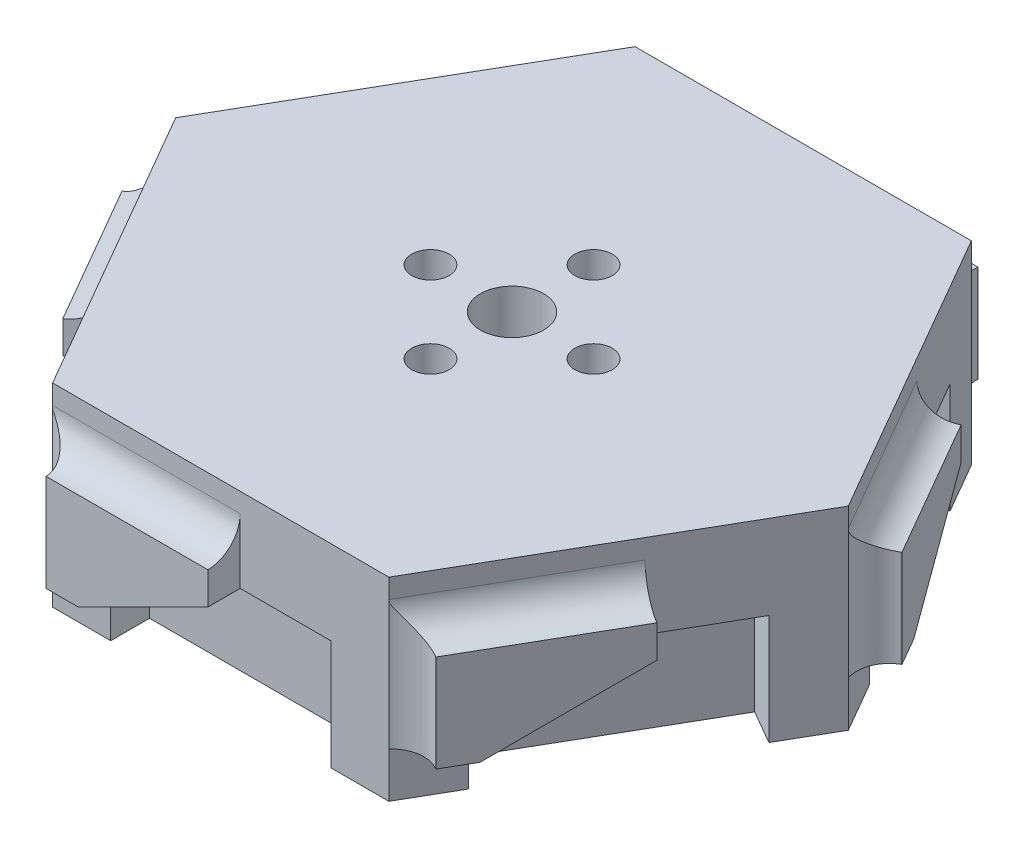
from build123d import *

# Parameters (mm, degrees)
BOSS_EXTRUDE1_DEPTH = 19.05
SKETCH2_W           = 10.795
SKETCH2_H           = 10.795
CUT_EXTRUDE1_DEPTH  = 3.81
BOSS_EXTRUDE2_DEPTH = 3.175
CIRPATTERN1_COUNT   = 6
SKETCH6_R           = 3.1
SKETCH6_R_2         = 1.83388
CUT_EXTRUDE3_DEPTH  = 51.595706367
FILLET1_R           = 3.175


with BuildPart() as part:
    # Sketch1 → Boss-Extrude1 (new body)
    with BuildSketch(Plane(origin=(0, 0, 0), x_dir=(1, 0, 0), z_dir=(0, 1, 0))):
        Polygon((16.497783942, 28.575), (-16.497783942, 28.575), (-32.995567884, 0), (-16.497783942, -28.575), (16.497783942, -28.575), (32.995567884, 0), align=None)
    extrude(amount=BOSS_EXTRUDE1_DEPTH)

    # Sketch2 → Cut-Extrude1 (cut)
    with BuildSketch(Plane(origin=(24.746675913, 0, 14.2875), x_dir=(0.4999999999999996, 0, -0.8660254037844389), z_dir=(0.8660254037844388, 0, 0.49999999999999956))):
        with Locations((-5.3975, 5.3975)):
            Rectangle(SKETCH2_W, SKETCH2_H)
        with Locations((5.3975, 5.3975)):
            Rectangle(SKETCH2_W, SKETCH2_H)
    cut_extrude1 = extrude(amount=-CUT_EXTRUDE1_DEPTH, mode=Mode.SUBTRACT)

    # Sketch3 → Boss-Extrude2 (add)
    with BuildSketch(Plane(origin=(24.746675913, 0, 14.2875), x_dir=(0.4999999999999996, 0, -0.8660254037844389), z_dir=(0.8660254037844388, 0, 0.49999999999999956))):
        Polygon((-13.97, 13.97), (-13.97, 4.445), (-10.795, 4.445), (1.905, 10.795), (1.905, 13.97), align=None)
    boss_extrude2 = extrude(amount=BOSS_EXTRUDE2_DEPTH)

    # CirPattern1: Cut-Extrude1, Boss-Extrude2 ×6 about axis
    cirpattern1_axis = Axis((0, 0, 0), (0, 1, 0))
    add([cut_extrude1.rotate(cirpattern1_axis, i * 360 / CIRPATTERN1_COUNT) for i in range(1, CIRPATTERN1_COUNT)], mode=Mode.SUBTRACT)
    add([boss_extrude2.rotate(cirpattern1_axis, i * 360 / CIRPATTERN1_COUNT) for i in range(1, CIRPATTERN1_COUNT)])

    # Sketch6 → Cut-Extrude3 (cut, through all)
    with BuildSketch(Plane(origin=(0, 19.05, 0), x_dir=(1, 0, 0), z_dir=(0, 1, 0))):
        with Locations(Location((0, 0, 0), (0, 0, 270))):
            Circle(SKETCH6_R)
        with Locations(Location((0, 8, 0), (0, 0, 270))):
            Circle(SKETCH6_R_2)
        with Locations(Location((8, 0, 0), (0, 0, 270))):
            Circle(SKETCH6_R_2)
        with Locations(Location((0, -8, 0), (0, 0, 270))):
            Circle(SKETCH6_R_2)
        with Locations(Location((-8, 0, 0), (0, 0, 270))):
            Circle(SKETCH6_R_2)
    extrude(amount=-CUT_EXTRUDE3_DEPTH, mode=Mode.SUBTRACT)

    # Fillet1
    # the kernel refuses this fillet: 3.175 mm, written as the material it adds along each edge
    with BuildSketch(Plane(origin=(-13.97, 13.97, 28.575), x_dir=(-1.0, -6.713789629229293e-15, 2.071656471641608e-12), z_dir=(0, -1, 0)), Plane(origin=(-31.731675913, 13.97, 2.189125109), x_dir=(-0.5000000000017967, -6.713789629229294e-15, -0.8660254037834013), z_dir=(0, -1, 0)), Plane(origin=(-17.761675913, 13.97, -26.385874891), x_dir=(0.4999999999982169, -6.713789629229294e-15, -0.866025403785468), z_dir=(0, -1, 0)), Plane(origin=(13.97, 13.97, -28.575), x_dir=(1.0, -6.713789629229294e-15, -2.032303431474765e-12), z_dir=(0, -1, 0)), Plane(origin=(31.731675913, 13.97, -2.189125109), x_dir=(0.5000000000017165, -6.7137896292292946e-15, 0.8660254037834476), z_dir=(0, -1, 0)), Plane(origin=(17.761675913, 13.97, 26.385874891), x_dir=(-0.49999999999821076, -6.713789629229294e-15, 0.8660254037854717), z_dir=(0, -1, 0))) as fillet1_piece_1:
        with BuildLine():
            CenterArc((3.175, -3.108333376), FILLET1_R, 101.762045639, 78.237954362)
            Line((0, -3.108333376), (-0.0635, -3.108333376))
            Line((-0.0635, -3.108333376), (-0.0635, 0))
            Line((-0.0635, 0), (0, 0.0635))
            ThreePointArc((0, 0.0635), (1.263891971, 0.0635), (2.514839621, 0.062166668))
            Line((2.514839621, 0.062166668), (2.527783942, 0))
        make_face()
    extrude(amount=9.525)
    with BuildSketch(Plane(origin=(1.905, 13.97, 28.575), x_dir=(0, 1, 0), z_dir=(-1, 0, 0)), Plane(origin=(-23.794175913, 13.97, 15.937278394), x_dir=(0, 1, 0), z_dir=(-0.5, 0, -0.8660254037844387)), Plane(origin=(-25.699175913, 13.97, -12.637721606), x_dir=(0, 1, 0), z_dir=(0.4999999999999997, 0, -0.8660254037844388)), Plane(origin=(-1.905, 13.97, -28.575), x_dir=(0, 1, 0), z_dir=(1, 0, 0)), Plane(origin=(23.794175913, 13.97, -15.937278394), x_dir=(0, 1, 0), z_dir=(0.5000000000000003, 0, 0.8660254037844386)), Plane(origin=(25.699175913, 13.97, 12.637721606), x_dir=(0, 1, 0), z_dir=(-0.4999999999999996, 0, 0.8660254037844389))) as fillet1_piece_2:
        with BuildLine():
            CenterArc((FILLET1_R, -FILLET1_R), FILLET1_R, 90, 90)
            Line((0, -FILLET1_R), (-FILLET1_R * 0.02, -FILLET1_R))
            Line((-FILLET1_R * 0.02, -FILLET1_R), (-FILLET1_R * 0.02, FILLET1_R * 0.02))
            Line((-FILLET1_R * 0.02, FILLET1_R * 0.02), (FILLET1_R, FILLET1_R * 0.02))
            Line((FILLET1_R, FILLET1_R * 0.02), (FILLET1_R, 0))
        make_face()
    extrude(amount=15.875)
    with BuildSketch(Plane(origin=(-13.97, 21.740833439, 28.575), x_dir=(-1.0, -6.713789629229294e-15, 2.08290019740361e-12), z_dir=(0, -1, 0))) as fillet1_piece_3a_section:
        with BuildLine():
            CenterArc((3.175, -3.108333376), FILLET1_R, 101.762045639, 78.237954362)
            Line((0, -3.108333376), (-0.0635, -3.108333376))
            Line((-0.0635, -3.108333376), (-0.0635, 0))
            Line((-0.0635, 0), (0, 0.0635))
            ThreePointArc((0, 0.0635), (1.263891971, 0.0635), (2.514839621, 0.062166668))
            Line((2.514839621, 0.062166668), (2.527783942, 0))
        make_face()
    fillet1_piece_3a = extrude(amount=17.295833439, mode=Mode.PRIVATE)
    fillet1_piece_3a = split(fillet1_piece_3a, bisect_by=Plane(origin=(-14.601274605, 19.05, 29.300800837), z_dir=(0, -1, 0)), keep=Keep.TOP, mode=Mode.PRIVATE)
    fillet1_piece_3a = split(fillet1_piece_3a, bisect_by=Plane(origin=(-14.601274605, 13.97, 29.300800837), z_dir=(0, 1, 0)), keep=Keep.TOP, mode=Mode.PRIVATE)
    with BuildSketch(Plane(origin=(1.905, 13.97, 28.575), x_dir=(0, 1, 0), z_dir=(-1, 0, 0))) as fillet1_piece_3b_section:
        with BuildLine():
            CenterArc((FILLET1_R, -FILLET1_R), FILLET1_R, 90, 90)
            Line((0, -FILLET1_R), (-FILLET1_R * 0.02, -FILLET1_R))
            Line((-FILLET1_R * 0.02, -FILLET1_R), (-FILLET1_R * 0.02, FILLET1_R * 0.02))
            Line((-FILLET1_R * 0.02, FILLET1_R * 0.02), (FILLET1_R, FILLET1_R * 0.02))
            Line((FILLET1_R, FILLET1_R * 0.02), (FILLET1_R, 0))
        make_face()
    fillet1_piece_3b = extrude(amount=23.8125, mode=Mode.PRIVATE)
    fillet1_piece_3b = split(fillet1_piece_3b, bisect_by=Plane(origin=(-15.883361885, 14.764439111, 29.63921022), z_dir=(0.8660254037844387, 0, -0.5000000000000003)), keep=Keep.TOP, mode=Mode.PRIVATE)
    fillet1_piece_3b = split(fillet1_piece_3b, bisect_by=Plane(origin=(-13.97, 14.764439111, 29.165775935), z_dir=(-1, 0, 0)), keep=Keep.TOP, mode=Mode.PRIVATE)
    fillet1_piece_3 = fillet1_piece_3a & fillet1_piece_3b
    add(fillet1_piece_3)
    with BuildSketch(Plane(origin=(-31.731675913, 21.740833439, 2.189125109), x_dir=(-0.5000000000018066, -6.7137896292292946e-15, -0.8660254037833955), z_dir=(0, -1, 0))) as fillet1_piece_4a_section:
        with BuildLine():
            CenterArc((3.175, -3.108333376), FILLET1_R, 101.762045639, 78.237954362)
            Line((0, -3.108333376), (-0.0635, -3.108333376))
            Line((-0.0635, -3.108333376), (-0.0635, 0))
            Line((-0.0635, 0), (0, 0.0635))
            ThreePointArc((0, 0.0635), (1.263891971, 0.0635), (2.514839621, 0.062166668))
            Line((2.514839621, 0.062166668), (2.527783942, 0))
        make_face()
    fillet1_piece_4a = extrude(amount=17.295833439, mode=Mode.PRIVATE)
    fillet1_piece_4a = split(fillet1_piece_4a, bisect_by=Plane(origin=(-32.675875179, 19.05, 2.005325683), z_dir=(0, -1, 0)), keep=Keep.TOP, mode=Mode.PRIVATE)
    fillet1_piece_4a = split(fillet1_piece_4a, bisect_by=Plane(origin=(-32.675875179, 13.97, 2.005325683), z_dir=(0, 1, 0)), keep=Keep.TOP, mode=Mode.PRIVATE)
    with BuildSketch(Plane(origin=(-23.794175913, 13.97, 15.937278394), x_dir=(0, 1, 0), z_dir=(-0.5, 0, -0.8660254037844387))) as fillet1_piece_4b_section:
        with BuildLine():
            CenterArc((FILLET1_R, -FILLET1_R), FILLET1_R, 90, 90)
            Line((0, -FILLET1_R), (-FILLET1_R * 0.02, -FILLET1_R))
            Line((-FILLET1_R * 0.02, -FILLET1_R), (-FILLET1_R * 0.02, FILLET1_R * 0.02))
            Line((-FILLET1_R * 0.02, FILLET1_R * 0.02), (FILLET1_R, FILLET1_R * 0.02))
            Line((FILLET1_R, FILLET1_R * 0.02), (FILLET1_R, 0))
        make_face()
    fillet1_piece_4b = extrude(amount=23.8125, mode=Mode.PRIVATE)
    fillet1_piece_4b = split(fillet1_piece_4b, bisect_by=Plane(origin=(-33.609989941, 14.764439111, 1.06421022), z_dir=(0.866025403784439, 0, 0.4999999999999995)), keep=Keep.TOP, mode=Mode.PRIVATE)
    fillet1_piece_4b = split(fillet1_piece_4b, bisect_by=Plane(origin=(-32.243302881, 14.764439111, 2.484513077), z_dir=(-0.5000000000000001, -6.713789629229295e-15, -0.8660254037844387)), keep=Keep.TOP, mode=Mode.PRIVATE)
    fillet1_piece_4 = fillet1_piece_4a & fillet1_piece_4b
    add(fillet1_piece_4)
    with BuildSketch(Plane(origin=(-17.761675913, 21.740833439, -26.385874891), x_dir=(0.4999999999982358, -6.713789629229293e-15, -0.8660254037854572), z_dir=(0, -1, 0))) as fillet1_piece_5a_section:
        with BuildLine():
            CenterArc((3.175, -3.108333376), FILLET1_R, 101.762045639, 78.237954362)
            Line((0, -3.108333376), (-0.0635, -3.108333376))
            Line((-0.0635, -3.108333376), (-0.0635, 0))
            Line((-0.0635, 0), (0, 0.0635))
            ThreePointArc((0, 0.0635), (1.263891971, 0.0635), (2.514839621, 0.062166668))
            Line((2.514839621, 0.062166668), (2.527783942, 0))
        make_face()
    fillet1_piece_5a = extrude(amount=17.295833439, mode=Mode.PRIVATE)
    fillet1_piece_5a = split(fillet1_piece_5a, bisect_by=Plane(origin=(-18.074600574, 19.05, -27.295475154), z_dir=(0, -1, 0)), keep=Keep.TOP, mode=Mode.PRIVATE)
    fillet1_piece_5a = split(fillet1_piece_5a, bisect_by=Plane(origin=(-18.074600574, 13.97, -27.295475154), z_dir=(0, 1, 0)), keep=Keep.TOP, mode=Mode.PRIVATE)
    with BuildSketch(Plane(origin=(-25.699175913, 13.97, -12.637721606), x_dir=(0, 1, 0), z_dir=(0.4999999999999997, 0, -0.8660254037844388))) as fillet1_piece_5b_section:
        with BuildLine():
            CenterArc((FILLET1_R, -FILLET1_R), FILLET1_R, 90, 90)
            Line((0, -FILLET1_R), (-FILLET1_R * 0.02, -FILLET1_R))
            Line((-FILLET1_R * 0.02, -FILLET1_R), (-FILLET1_R * 0.02, FILLET1_R * 0.02))
            Line((-FILLET1_R * 0.02, FILLET1_R * 0.02), (FILLET1_R, FILLET1_R * 0.02))
            Line((FILLET1_R, FILLET1_R * 0.02), (FILLET1_R, 0))
        make_face()
    fillet1_piece_5b = extrude(amount=23.8125, mode=Mode.PRIVATE)
    fillet1_piece_5b = split(fillet1_piece_5b, bisect_by=Plane(origin=(-17.726628056, 14.764439111, -28.575), z_dir=(0, 0, 1)), keep=Keep.TOP, mode=Mode.PRIVATE)
    fillet1_piece_5b = split(fillet1_piece_5b, bisect_by=Plane(origin=(-18.273302881, 14.764439111, -26.681262858), z_dir=(0.49999999999999967, -6.713789629229293e-15, -0.8660254037844388)), keep=Keep.TOP, mode=Mode.PRIVATE)
    fillet1_piece_5 = fillet1_piece_5a & fillet1_piece_5b
    add(fillet1_piece_5)
    with BuildSketch(Plane(origin=(13.97, 21.740833439, -28.575), x_dir=(1.0, -6.713789629229293e-15, -2.0351143629152955e-12), z_dir=(0, -1, 0))) as fillet1_piece_6a_section:
        with BuildLine():
            CenterArc((3.175, -3.108333376), FILLET1_R, 101.762045639, 78.237954362)
            Line((0, -3.108333376), (-0.0635, -3.108333376))
            Line((-0.0635, -3.108333376), (-0.0635, 0))
            Line((-0.0635, 0), (0, 0.0635))
            ThreePointArc((0, 0.0635), (1.263891971, 0.0635), (2.514839621, 0.062166668))
            Line((2.514839621, 0.062166668), (2.527783942, 0))
        make_face()
    fillet1_piece_6a = extrude(amount=17.295833439, mode=Mode.PRIVATE)
    fillet1_piece_6a = split(fillet1_piece_6a, bisect_by=Plane(origin=(14.601274605, 19.05, -29.300800837), z_dir=(0, -1, 0)), keep=Keep.TOP, mode=Mode.PRIVATE)
    fillet1_piece_6a = split(fillet1_piece_6a, bisect_by=Plane(origin=(14.601274605, 13.97, -29.300800837), z_dir=(0, 1, 0)), keep=Keep.TOP, mode=Mode.PRIVATE)
    with BuildSketch(Plane(origin=(-1.905, 13.97, -28.575), x_dir=(0, 1, 0), z_dir=(1, 0, 0))) as fillet1_piece_6b_section:
        with BuildLine():
            CenterArc((FILLET1_R, -FILLET1_R), FILLET1_R, 90, 90)
            Line((0, -FILLET1_R), (-FILLET1_R * 0.02, -FILLET1_R))
            Line((-FILLET1_R * 0.02, -FILLET1_R), (-FILLET1_R * 0.02, FILLET1_R * 0.02))
            Line((-FILLET1_R * 0.02, FILLET1_R * 0.02), (FILLET1_R, FILLET1_R * 0.02))
            Line((FILLET1_R, FILLET1_R * 0.02), (FILLET1_R, 0))
        make_face()
    fillet1_piece_6b = extrude(amount=23.8125, mode=Mode.PRIVATE)
    fillet1_piece_6b = split(fillet1_piece_6b, bisect_by=Plane(origin=(15.883361885, 14.764439111, -29.63921022), z_dir=(-0.8660254037844387, 0, 0.5000000000000003)), keep=Keep.TOP, mode=Mode.PRIVATE)
    fillet1_piece_6b = split(fillet1_piece_6b, bisect_by=Plane(origin=(13.97, 14.764439111, -29.165775935), z_dir=(1, 0, 0)), keep=Keep.TOP, mode=Mode.PRIVATE)
    fillet1_piece_6 = fillet1_piece_6a & fillet1_piece_6b
    add(fillet1_piece_6)
    with BuildSketch(Plane(origin=(31.731675913, 21.740833439, -2.189125109), x_dir=(0.5000000000017293, -6.713789629229294e-15, 0.8660254037834403), z_dir=(0, -1, 0))) as fillet1_piece_7a_section:
        with BuildLine():
            CenterArc((3.175, -3.108333376), FILLET1_R, 101.762045639, 78.237954362)
            Line((0, -3.108333376), (-0.0635, -3.108333376))
            Line((-0.0635, -3.108333376), (-0.0635, 0))
            Line((-0.0635, 0), (0, 0.0635))
            ThreePointArc((0, 0.0635), (1.263891971, 0.0635), (2.514839621, 0.062166668))
            Line((2.514839621, 0.062166668), (2.527783942, 0))
        make_face()
    fillet1_piece_7a = extrude(amount=17.295833439, mode=Mode.PRIVATE)
    fillet1_piece_7a = split(fillet1_piece_7a, bisect_by=Plane(origin=(32.675875179, 19.05, -2.005325683), z_dir=(0, -1, 0)), keep=Keep.TOP, mode=Mode.PRIVATE)
    fillet1_piece_7a = split(fillet1_piece_7a, bisect_by=Plane(origin=(32.675875179, 13.97, -2.005325683), z_dir=(0, 1, 0)), keep=Keep.TOP, mode=Mode.PRIVATE)
    with BuildSketch(Plane(origin=(23.794175913, 13.97, -15.937278394), x_dir=(0, 1, 0), z_dir=(0.5000000000000003, 0, 0.8660254037844386))) as fillet1_piece_7b_section:
        with BuildLine():
            CenterArc((FILLET1_R, -FILLET1_R), FILLET1_R, 90, 90)
            Line((0, -FILLET1_R), (-FILLET1_R * 0.02, -FILLET1_R))
            Line((-FILLET1_R * 0.02, -FILLET1_R), (-FILLET1_R * 0.02, FILLET1_R * 0.02))
            Line((-FILLET1_R * 0.02, FILLET1_R * 0.02), (FILLET1_R, FILLET1_R * 0.02))
            Line((FILLET1_R, FILLET1_R * 0.02), (FILLET1_R, 0))
        make_face()
    fillet1_piece_7b = extrude(amount=23.8125, mode=Mode.PRIVATE)
    fillet1_piece_7b = split(fillet1_piece_7b, bisect_by=Plane(origin=(33.609989941, 14.764439111, -1.06421022), z_dir=(-0.8660254037844389, 0, -0.4999999999999995)), keep=Keep.TOP, mode=Mode.PRIVATE)
    fillet1_piece_7b = split(fillet1_piece_7b, bisect_by=Plane(origin=(32.243302881, 14.764439111, -2.484513077), z_dir=(0.5000000000000004, -6.713789629229294e-15, 0.8660254037844385)), keep=Keep.TOP, mode=Mode.PRIVATE)
    fillet1_piece_7 = fillet1_piece_7a & fillet1_piece_7b
    add(fillet1_piece_7)
    with BuildSketch(Plane(origin=(17.761675913, 21.740833439, 26.385874891), x_dir=(-0.49999999999824063, -6.7137896292292946e-15, 0.8660254037854545), z_dir=(0, -1, 0))) as fillet1_piece_8a_section:
        with BuildLine():
            CenterArc((3.175, -3.108333376), FILLET1_R, 101.762045639, 78.237954362)
            Line((0, -3.108333376), (-0.0635, -3.108333376))
            Line((-0.0635, -3.108333376), (-0.0635, 0))
            Line((-0.0635, 0), (0, 0.0635))
            ThreePointArc((0, 0.0635), (1.263891971, 0.0635), (2.514839621, 0.062166668))
            Line((2.514839621, 0.062166668), (2.527783942, 0))
        make_face()
    fillet1_piece_8a = extrude(amount=17.295833439, mode=Mode.PRIVATE)
    fillet1_piece_8a = split(fillet1_piece_8a, bisect_by=Plane(origin=(18.074600574, 19.05, 27.295475154), z_dir=(0, -1, 0)), keep=Keep.TOP, mode=Mode.PRIVATE)
    fillet1_piece_8a = split(fillet1_piece_8a, bisect_by=Plane(origin=(18.074600574, 13.97, 27.295475154), z_dir=(0, 1, 0)), keep=Keep.TOP, mode=Mode.PRIVATE)
    with BuildSketch(Plane(origin=(25.699175913, 13.97, 12.637721606), x_dir=(0, 1, 0), z_dir=(-0.4999999999999996, 0, 0.8660254037844389))) as fillet1_piece_8b_section:
        with BuildLine():
            CenterArc((FILLET1_R, -FILLET1_R), FILLET1_R, 90, 90)
            Line((0, -FILLET1_R), (-FILLET1_R * 0.02, -FILLET1_R))
            Line((-FILLET1_R * 0.02, -FILLET1_R), (-FILLET1_R * 0.02, FILLET1_R * 0.02))
            Line((-FILLET1_R * 0.02, FILLET1_R * 0.02), (FILLET1_R, FILLET1_R * 0.02))
            Line((FILLET1_R, FILLET1_R * 0.02), (FILLET1_R, 0))
        make_face()
    fillet1_piece_8b = extrude(amount=23.8125, mode=Mode.PRIVATE)
    fillet1_piece_8b = split(fillet1_piece_8b, bisect_by=Plane(origin=(17.726628056, 14.764439111, 28.575), z_dir=(0, 0, -1)), keep=Keep.TOP, mode=Mode.PRIVATE)
    fillet1_piece_8b = split(fillet1_piece_8b, bisect_by=Plane(origin=(18.273302881, 14.764439111, 26.681262858), z_dir=(-0.49999999999999956, -6.713789629229294e-15, 0.8660254037844389)), keep=Keep.TOP, mode=Mode.PRIVATE)
    fillet1_piece_8 = fillet1_piece_8a & fillet1_piece_8b
    add(fillet1_piece_8)


solid = part.part
